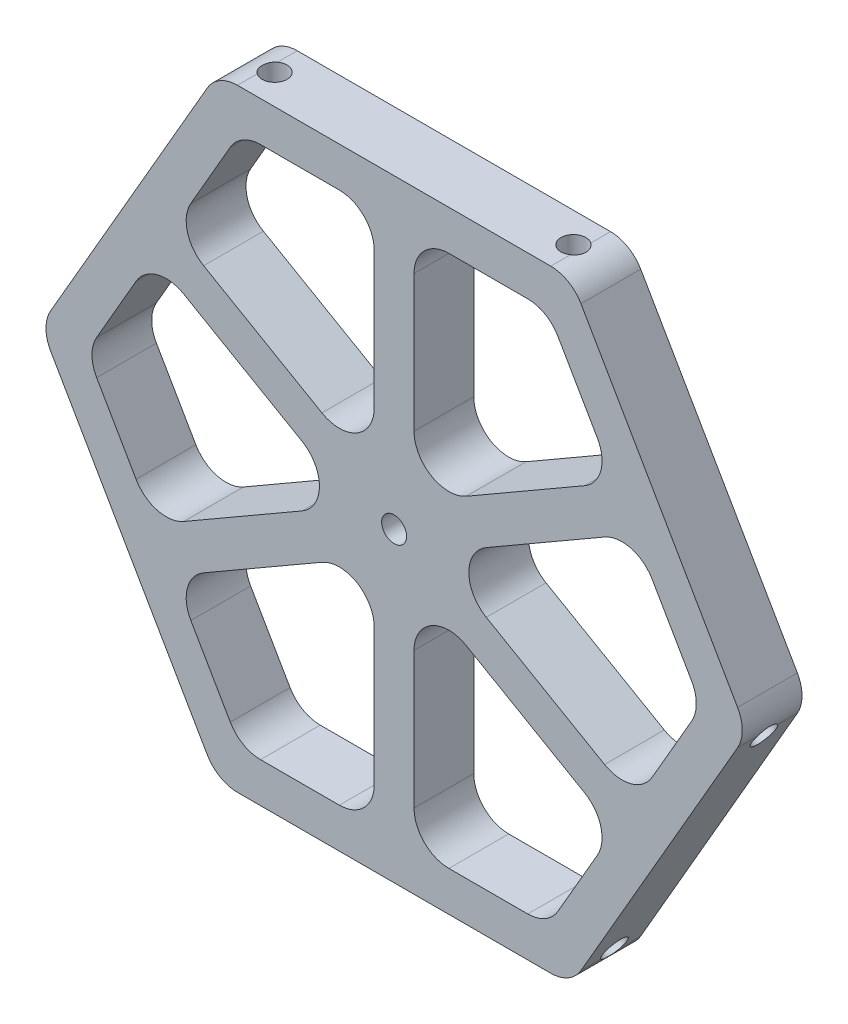
from build123d import *

# Parameters (mm, degrees)
SKETCH1_R           = 1.25
BOSS_EXTRUDE4_DEPTH = 6
FILLET1_R           = 3.5
SKETCH2_R           = 1.25
CUT_EXTRUDE1_DEPTH  = 3
CIRPATTERN1_COUNT   = 3
SKETCH3_R           = 1.25
BOSS_EXTRUDE5_DEPTH = 1


with BuildPart() as part:
    # Sketch1 → Boss-Extrude4 (new body)
    with BuildSketch(Plane.XY):
        Polygon((0, -30.73871501), (17.747005386, -30.73871501), (26.620508078, -15.369357505), (35.494010771, 0), (26.620508078, 15.369357505), (17.747005386, 30.73871501), (0, 30.73871501), (-17.747005386, 30.73871501), (-26.620508078, 15.369357505), (-35.494010771, 0), (-26.620508078, -15.369357505), (-17.747005386, -30.73871501), align=None)
        Circle(SKETCH1_R, mode=Mode.SUBTRACT)
        Polygon((-2, 3.464101615), (-2, 26.73871501), (-15.437604309, 26.73871501), (-22.156406463, 15.101408313), align=None, mode=Mode.SUBTRACT)
        Polygon((-4, 0), (-24.156406463, -11.637306697), (-30.875208618, 0), (-24.156406463, 11.637306697), align=None, mode=Mode.SUBTRACT)
        Polygon((2, 3.464101615), (22.156406463, 15.101408313), (15.437604309, 26.73871501), (2, 26.73871501), align=None, mode=Mode.SUBTRACT)
        Polygon((4, 0), (24.156406463, -11.637306697), (30.875208618, 0), (24.156406463, 11.637306697), align=None, mode=Mode.SUBTRACT)
        Polygon((-2, -3.464101615), (-2, -26.73871501), (-15.437604309, -26.73871501), (-22.156406463, -15.101408313), align=None, mode=Mode.SUBTRACT)
        Polygon((2, -3.464101615), (2, -26.73871501), (15.437604309, -26.73871501), (22.156406463, -15.101408313), align=None, mode=Mode.SUBTRACT)
    extrude(amount=BOSS_EXTRUDE4_DEPTH)

    # Fillet1
    fillet1_edges = [part.edges().sort_by_distance(p)[0] for p in [
        (-2, 3.464101615, 3),
        (2, 3.464101615, 3),
        (4, 0, 3),
        (2, -3.464101615, 3),
        (-2, -3.464101615, 3),
        (-4, 0, 3),
        (2, 26.73871501, 3),
        (15.437604309, 26.73871501, 3),
        (22.156406463, 15.101408313, 3),
        (24.156406463, 11.637306697, 3),
        (30.875208618, 0, 3),
        (24.156406463, -11.637306697, 3),
        (22.156406463, -15.101408313, 3),
        (15.437604309, -26.73871501, 3),
        (2, -26.73871501, 3),
        (-2, -26.73871501, 3),
        (-15.437604309, -26.73871501, 3),
        (-22.156406463, -15.101408313, 3),
        (-24.156406463, -11.637306697, 3),
        (-30.875208618, 0, 3),
        (-24.156406463, 11.637306697, 3),
        (-22.156406463, 15.101408313, 3),
        (-15.437604309, 26.73871501, 3),
        (-2, 26.73871501, 3),
        (-35.494010771, 0, 3),
        (-17.747005386, 30.73871501, 3),
        (17.747005386, 30.73871501, 3),
        (35.494010771, 0, 3),
        (17.747005386, -30.73871501, 3),
        (-17.747005386, -30.73871501, 3),
    ]]
    fillet(fillet1_edges, radius=FILLET1_R)

    # Sketch2 → Cut-Extrude1 (cut)
    with BuildSketch(Plane(origin=(-26.620508078, -15.369357505, 0), x_dir=(0, 0, 1), z_dir=(-0.8660254037844386, -0.5000000000000001, 0))):
        with Locations((3, 15)):
            Circle(SKETCH2_R)
        with Locations((3, -15)):
            Circle(SKETCH2_R)
    cut_extrude1 = extrude(amount=-CUT_EXTRUDE1_DEPTH, mode=Mode.SUBTRACT)

    # CirPattern1: Cut-Extrude1 ×3 about axis
    cirpattern1_axis = Axis((0, 0, 6), (0, 0, 1))
    for i in range(1, CIRPATTERN1_COUNT):
        add(cut_extrude1.rotate(cirpattern1_axis, i * 360 / CIRPATTERN1_COUNT), mode=Mode.SUBTRACT)

    # Sketch3 → Boss-Extrude5 (add)
    with BuildSketch(Plane(origin=(0, 0, 0), x_dir=(-1, 0, 0), z_dir=(0, 0, -1))):
        Circle(SKETCH3_R)
    extrude(amount=-BOSS_EXTRUDE5_DEPTH)


solid = part.part
